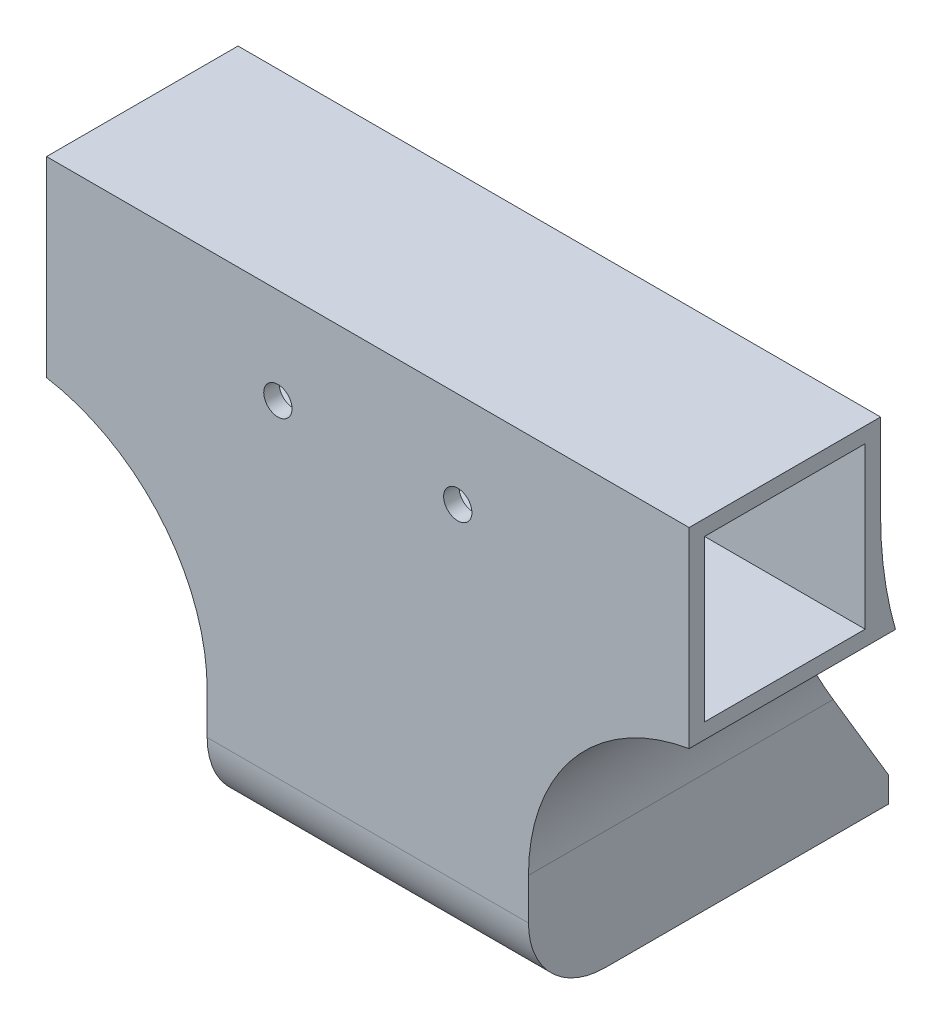
from build123d import *

# Parameters (mm, degrees)
SKETCH_1_W          = 25
SKETCH_1_H          = 25
EXTRUDE_1_DEPTH     = 100
EXTRUDE_1_2_DEPTH   = 48
SKETCH_3_W          = 50.00000000000001
SKETCH_3_H          = 4
EXTRUDE_2_DEPTH     = 42
EXTRUDE_3_DEPTH     = 4
EXTRUDE_4_DEPTH     = 4
FILLET_2_R          = 30
CUT_EXTRUDE_1_REACH = 135.199
SKETCH_6_R          = 11.500000000000005
SKETCH_6_R_2        = 1.6000000000000052
SKETCH_6_R_3        = 1.5999999999999974
SKETCH_6_R_4        = 1.600000000000006
FILLET_3_R          = 12
FILLET_4_R          = 60
SKETCH_7_R          = 2.1999999999999984
CUT_EXTRUDE_2_DEPTH = 122.8378021221657
FILLET_5_R          = 2
SKETCH_8_R          = 1.2000000000000004
SKETCH_8_R_2        = 1.1999999999999995
CUT_EXTRUDE_3_DEPTH = 5
EXTRUDE_START       = 1
SKETCH_9_R          = 1.2000000000000004
SKETCH_9_R_2        = 1.1999999999999986
EXTRUDE_5_DEPTH     = 1
FILLET_6_R          = 1


# Some blends are built 0.0001 mm under size
with BuildPart() as part:
    # Эскиз1 → Extrude 1 (new body)
    with BuildSketch(Plane(origin=(0, 0, 0), x_dir=(0, 0, -1), z_dir=(1, 0, 0))):
        Polygon((14.899999999999997, 14.899999999999999), (-14.900000000000006, 14.899999999999999), (-14.900000000000004, -14.899999999999999), (14.899999999999993, -14.900000000000002), align=None)
        Rectangle(SKETCH_1_W, SKETCH_1_H, mode=Mode.SUBTRACT)
    extrude(amount=EXTRUDE_1_DEPTH)

    # Эскиз2 → Extrude 1 2 (add)
    with BuildSketch(Plane.XZ.offset(14.900000000000002)):
        Polygon((25.000000000000007, 0.9000000000000085), (75.00000000000001, 0.9000000000000085), (75.00000000000001, 14.900000000000016), (25.000000000000007, 14.90000000000001), align=None)
    extrude(amount=EXTRUDE_1_2_DEPTH)

    # Эскиз3 → Бобышка-Вытянуть2 (add)
    with BuildSketch(Plane(origin=(0, 0, 0.9000000000000085), x_dir=(-1, 0, 0), z_dir=(0, 0, -1))):
        with Locations((-50.000000000000014, -60.89999999999999)):
            Rectangle(SKETCH_3_W, SKETCH_3_H)
    extrude(amount=EXTRUDE_2_DEPTH)

    # Эскиз4 → Бобышка-Вытянуть3 (add)
    with BuildSketch(Plane(origin=(75.00000000000001, 0, 0), x_dir=(0, 0, -1), z_dir=(1, 0, 0))):
        Polygon((14.899999999999997, -14.900000000000002), (41.099999999999994, -58.89999999999999), (-0.9000000000000085, -58.89999999999999), (-0.9000000000000032, -14.900000000000002), align=None)
    extrude(amount=-EXTRUDE_3_DEPTH)

    # Эскиз5 → Бобышка-Вытянуть4 (add)
    with BuildSketch(Plane.ZY.offset(-25.000000000000007)):
        Polygon((-41.099999999999994, -58.89999999999999), (-14.899999999999997, -14.900000000000002), (0.9000000000000032, -14.900000000000002), (0.9000000000000085, -58.89999999999999), align=None)
    extrude(amount=-EXTRUDE_4_DEPTH)

    # Скругление2
    # the kernel refuses this fillet: 30 mm, written as the material it adds along each edge
    with BuildSketch(Plane(origin=(75.00000000000001, -14.900000000000002, 14.900000000000016), x_dir=(1, -1.1724e-13, 0), z_dir=(0, 0, -1))) as fillet_2_piece_1_section:
        with BuildLine():
            CenterArc((30.000000000003467, 29.58039891549758), FILLET_2_R, 179.9999999999933, 80.40593177314048)
            Line((3.46799e-12, 29.580398915501096), (-0.5999999999965263, 29.580398915501167))
            Line((-0.5999999999965263, 29.580398915501167), (-0.5999999999999943, 7.034e-14))
            Line((-0.5999999999999943, 7.034e-14), (-7.034e-14, -0.5999999999999996))
            ThreePointArc((-7.034e-14, -0.5999999999999996), (12.50000000000017, -0.6000000000014687), (24.900000000000418, -0.5916079783099508))
            Line((24.900000000000418, -0.5916079783099508), (25.000000000000483, 0))
        make_face()
    fillet_2_piece_1 = extrude(amount=29.80000000000001, mode=Mode.PRIVATE)
    fillet_2_piece_1 = split(fillet_2_piece_1, bisect_by=Plane(origin=(81.1670170800043, -13.413841962792697, -14.0150604414811), z_dir=(0, -0.5116211753096359, 0.8592111341077854)), keep=Keep.TOP, mode=Mode.PRIVATE)
    add(fillet_2_piece_1)
    with BuildSketch(Plane(origin=(75.00000000000001, -14.900000000000002, 14.900000000000016), x_dir=(1, -1.1724e-13, 0), z_dir=(0, 0, -1))) as fillet_2_piece_2_section:
        with BuildLine():
            CenterArc((30.000000000003467, 29.58039891549758), FILLET_2_R, 179.9999999999933, 80.40593177314048)
            Line((3.46799e-12, 29.580398915501096), (-0.5999999999965263, 29.580398915501167))
            Line((-0.5999999999965263, 29.580398915501167), (-0.5999999999999943, 7.034e-14))
            Line((-0.5999999999999943, 7.034e-14), (-7.034e-14, -0.5999999999999996))
            ThreePointArc((-7.034e-14, -0.5999999999999996), (12.50000000000017, -0.6000000000014687), (24.900000000000418, -0.5916079783099508))
            Line((24.900000000000418, -0.5916079783099508), (25.000000000000483, 0))
        make_face()
    fillet_2_piece_2 = extrude(amount=103.75099728875276, mode=Mode.PRIVATE)
    fillet_2_piece_2 = split(fillet_2_piece_2, bisect_by=Plane(origin=(78.03670654551321, -27.69206450172471, -14.899999999999991), z_dir=(0, -1.2e-16, -1)), keep=Keep.TOP, mode=Mode.PRIVATE)
    fillet_2_piece_2 = split(fillet_2_piece_2, bisect_by=Plane(origin=(78.03670654551321, -26.01786323182673, -21.520182197133188), z_dir=(0, -0.5116211753096359, 0.8592111341077854)), keep=Keep.TOP, mode=Mode.PRIVATE)
    add(fillet_2_piece_2)
    with BuildSketch(Plane(origin=(75.00000000000001, -14.900000000000002, 14.900000000000016), x_dir=(1, -1.1724e-13, 0), z_dir=(0, 0, -1))) as fillet_2_piece_3_section:
        with BuildLine():
            CenterArc((30.000000000003467, 29.58039891549758), FILLET_2_R, 179.9999999999933, 80.40593177314048)
            Line((3.46799e-12, 29.580398915501096), (-0.5999999999965263, 29.580398915501167))
            Line((-0.5999999999965263, 29.580398915501167), (-0.5999999999999943, 7.034e-14))
            Line((-0.5999999999999943, 7.034e-14), (-7.034e-14, -0.5999999999999996))
            ThreePointArc((-7.034e-14, -0.5999999999999996), (12.50000000000017, -0.6000000000014687), (24.900000000000418, -0.5916079783099508))
            Line((24.900000000000418, -0.5916079783099508), (25.000000000000483, 0))
        make_face()
    fillet_2_piece_3 = extrude(amount=29.80000000000001, mode=Mode.PRIVATE)
    fillet_2_piece_3 = split(fillet_2_piece_3, bisect_by=Plane(origin=(87.30790234875249, -14.553945511924846, -14.6939402821007), z_dir=(0, 0.5116211753096359, -0.8592111341077854)), keep=Keep.TOP, mode=Mode.PRIVATE)
    add(fillet_2_piece_3)
    with BuildSketch(Plane(origin=(25.000000000000007, -14.900000000000011, -88.85099728875262), x_dir=(0, -1, 0), z_dir=(0, 0, 1))) as fillet_2_piece_4_section:
        with BuildLine():
            CenterArc((29.5803989155011, -30), FILLET_2_R, 90, 80.40593177314054)
            Line((2.93632e-12, -25.000000000000504), (-0.5916079783070263, -24.900000000000514))
            ThreePointArc((-0.5916079783070263, -24.900000000000514), (-0.5999999999999996, -12.500000000000252), (-0.5999999999999996, 0))
            Line((-0.5999999999999996, 0), (0, 0.6000000000000014))
            Line((0, 0.6000000000000014), (29.5803989155011, 0.6000000000000014))
            Line((29.5803989155011, 0.6000000000000014), (29.5803989155011, 0))
        make_face()
    fillet_2_piece_4 = extrude(amount=103.75099728875263, mode=Mode.PRIVATE)
    fillet_2_piece_4 = split(fillet_2_piece_4, bisect_by=Plane(origin=(21.96329345452578, -26.01786323182675, -21.5201821971332), z_dir=(0, -0.5116211753096359, 0.8592111341077854)), keep=Keep.TOP, mode=Mode.PRIVATE)
    fillet_2_piece_4 = split(fillet_2_piece_4, bisect_by=Plane(origin=(21.96329345452578, -27.69206450173281, -14.899999999999991), z_dir=(0, -1.2e-16, -1)), keep=Keep.TOP, mode=Mode.PRIVATE)
    add(fillet_2_piece_4)
    with BuildSketch(Plane(origin=(25.000000000000007, -14.900000000000002, -14.899999999999997), x_dir=(0, -1, 0), z_dir=(0, 0, 1))) as fillet_2_piece_5_section:
        with BuildLine():
            CenterArc((29.58039891550111, -30), FILLET_2_R, 90, 80.40593177314054)
            Line((2.9452e-12, -25.000000000000504), (-0.5916079783070174, -24.900000000000514))
            ThreePointArc((-0.5916079783070174, -24.900000000000514), (-0.5999999999999996, -12.500000000000252), (-0.5999999999999996, 0))
            Line((-0.5999999999999996, 0), (0, 0.6000000000000014))
            Line((0, 0.6000000000000014), (29.58039891550111, 0.6000000000000014))
            Line((29.58039891550111, 0.6000000000000014), (29.58039891550111, 0))
        make_face()
    fillet_2_piece_5 = extrude(amount=29.800000000000004, mode=Mode.PRIVATE)
    fillet_2_piece_5 = split(fillet_2_piece_5, bisect_by=Plane(origin=(12.6920976512564, -14.55394551192456, -14.693940282100531), z_dir=(0, 0.5116211753096359, -0.8592111341077854)), keep=Keep.TOP, mode=Mode.PRIVATE)
    add(fillet_2_piece_5)
    with BuildSketch(Plane(origin=(25.000000000000007, -14.900000000000002, -14.899999999999997), x_dir=(0, -1, 0), z_dir=(0, 0, 1))) as fillet_2_piece_6_section:
        with BuildLine():
            CenterArc((29.58039891550111, -30), FILLET_2_R, 90, 80.40593177314054)
            Line((2.9452e-12, -25.000000000000504), (-0.5916079783070174, -24.900000000000514))
            ThreePointArc((-0.5916079783070174, -24.900000000000514), (-0.5999999999999996, -12.500000000000252), (-0.5999999999999996, 0))
            Line((-0.5999999999999996, 0), (0, 0.6000000000000014))
            Line((0, 0.6000000000000014), (29.58039891550111, 0.6000000000000014))
            Line((29.58039891550111, 0.6000000000000014), (29.58039891550111, 0))
        make_face()
    fillet_2_piece_6 = extrude(amount=29.800000000000004, mode=Mode.PRIVATE)
    fillet_2_piece_6 = split(fillet_2_piece_6, bisect_by=Plane(origin=(18.83298291999507, -13.413841962792766, -14.015060441481143), z_dir=(0, -0.5116211753096359, 0.8592111341077854)), keep=Keep.TOP, mode=Mode.PRIVATE)
    add(fillet_2_piece_6)

    # Эскиз6 → Вырез-Вытянуть1 (cut, up to next)
    with BuildSketch(Plane.XZ.offset(62.9), mode=Mode.PRIVATE) as cut_extrude_1_sk1:
        with Locations(Location((50.00000000000001, -20.099999999999998, 0), (0, 0, 270))):
            Circle(SKETCH_6_R)
    cut_extrude_1_tool1 = extrude(cut_extrude_1_sk1.sketch, amount=-CUT_EXTRUDE_1_REACH, mode=Mode.PRIVATE) & part.part
    # Эскиз6 → Вырез-Вытянуть1 (cut, up to next)
    with BuildSketch(Plane.XZ.offset(62.9), mode=Mode.PRIVATE) as cut_extrude_1_sk2:
        with Locations(Location((34.50000000000001, -4.599999999999993, 0), (0, 0, 270))):
            Circle(SKETCH_6_R_2)
    cut_extrude_1_tool2 = extrude(cut_extrude_1_sk2.sketch, amount=-CUT_EXTRUDE_1_REACH, mode=Mode.PRIVATE) & part.part
    # Эскиз6 → Вырез-Вытянуть1 (cut, up to next)
    with BuildSketch(Plane.XZ.offset(62.9), mode=Mode.PRIVATE) as cut_extrude_1_sk3:
        with Locations(Location((65.5, -4.599999999999993, 0), (0, 0, 270))):
            Circle(SKETCH_6_R_2)
    cut_extrude_1_tool3 = extrude(cut_extrude_1_sk3.sketch, amount=-CUT_EXTRUDE_1_REACH, mode=Mode.PRIVATE) & part.part
    # Эскиз6 → Вырез-Вытянуть1 (cut, up to next)
    with BuildSketch(Plane.XZ.offset(62.9), mode=Mode.PRIVATE) as cut_extrude_1_sk4:
        with Locations(Location((34.50000000000001, -35.599999999999994, 0), (0, 0, 270))):
            Circle(SKETCH_6_R_3)
    cut_extrude_1_tool4 = extrude(cut_extrude_1_sk4.sketch, amount=-CUT_EXTRUDE_1_REACH, mode=Mode.PRIVATE) & part.part
    # Эскиз6 → Вырез-Вытянуть1 (cut, up to next)
    with BuildSketch(Plane.XZ.offset(62.9), mode=Mode.PRIVATE) as cut_extrude_1_sk5:
        with Locations(Location((65.5, -35.599999999999994, 0), (0, 0, 270))):
            Circle(SKETCH_6_R_4)
    cut_extrude_1_tool5 = extrude(cut_extrude_1_sk5.sketch, amount=-CUT_EXTRUDE_1_REACH, mode=Mode.PRIVATE) & part.part
    add(cut_extrude_1_tool1.solids().sort_by_distance((50, -62.9, -20.1))[0], mode=Mode.SUBTRACT)
    add(cut_extrude_1_tool2.solids().sort_by_distance((34.5, -62.9, -4.6))[0], mode=Mode.SUBTRACT)
    add(cut_extrude_1_tool3.solids().sort_by_distance((65.5, -62.9, -4.6))[0], mode=Mode.SUBTRACT)
    add(cut_extrude_1_tool4.solids().sort_by_distance((34.5, -62.9, -35.6))[0], mode=Mode.SUBTRACT)
    add(cut_extrude_1_tool5.solids().sort_by_distance((65.5, -62.9, -35.6))[0], mode=Mode.SUBTRACT)

    # Скругление3
    fillet_3_edges = [part.edges().sort_by_distance(p)[0] for p in [
        (50.000000000000014, -62.900000000000006, 14.900000000000013),
    ]]
    fillet(fillet_3_edges, radius=FILLET_3_R)

    # Скругление4
    fillet_4_edges = [part.edges().sort_by_distance(p)[0] for p in [
        (14.499999999999712, -14.900000000000967, -14.899999999999435),
        (85.49999999999991, -14.900000000000125, -14.899999999999999),
    ]]
    fillet(fillet_4_edges, radius=FILLET_4_R)

    # Эскиз7 → Вырез-Вытянуть2 (cut, through all)
    with BuildSketch(Plane(origin=(0, 0, -14.899999999999997), x_dir=(-1, 0, 0), z_dir=(0, 0, -1))):
        with Locations((-64, -7.84e-15)):
            Circle(SKETCH_7_R)
        with Locations((-36, -4.41e-15)):
            Circle(SKETCH_7_R)
    extrude(amount=-CUT_EXTRUDE_2_DEPTH, mode=Mode.SUBTRACT)

    # Скругление5
    fillet_5_edges = [part.edges().sort_by_distance(p)[0] for p in [
        (50.000000000000014, -14.900000000000002, -14.899999999999993),
    ]]
    fillet(fillet_5_edges, radius=FILLET_5_R)

    # Эскиз8 → Вырез-Вытянуть3 (cut)
    with BuildSketch(Plane.ZY.offset(-25.000000000000007)):
        with Locations((-25.099999999999998, -60.9)):
            Circle(SKETCH_8_R)
        with Locations((2.9000000000000035, -60.9)):
            Circle(SKETCH_8_R_2)
    extrude(amount=-CUT_EXTRUDE_3_DEPTH, mode=Mode.SUBTRACT)

    # Эскиз9 → Бобышка-Вытянуть5 (add)
    # profile 1 of 2: a face of its own
    with BuildSketch(Plane.ZY.offset(-25.000000000000007).offset(EXTRUDE_START)):
        with BuildLine():
            Line((-27.336067977499788, -62.9), (-22.863932022500208, -62.9))
            ThreePointArc((-22.863932022500208, -62.9), (-25.099999999999998, -57.9), (-27.336067977499788, -62.9))
        make_face()
        with Locations((-25.099999999999998, -60.9)):
            Circle(SKETCH_9_R, mode=Mode.SUBTRACT)
    # profile 2 of 2: a face of its own
    with BuildSketch(Plane.ZY.offset(-25.000000000000007).offset(EXTRUDE_START)):
        with BuildLine():
            Line((2.9000000000000035, -62.9), (0.6463835715880533, -62.9))
            ThreePointArc((0.6463835715880533, -62.9), (2.5917609374486457, -57.90270527196178), (5.513498770016945, -62.39947030164927))
            ThreePointArc((5.513498770016945, -62.39947030164927), (4.213782424449112, -62.686457926692185), (2.9000000000000035, -62.9))
        make_face()
        with Locations((2.9000000000000035, -60.9)):
            Circle(SKETCH_9_R_2, mode=Mode.SUBTRACT)
    extrude(amount=-EXTRUDE_5_DEPTH)

    # Скругление6
    fillet_6_edges = [part.edges().sort_by_distance(p)[0] for p in [
        (25.000000000000007, -57.90270527196177, 2.59176093744865),
        (25.000000000000007, -57.9, -25.099999999999998),
    ]]
    fillet(fillet_6_edges, radius=FILLET_6_R - 0.0001)  # a hair under: the kernel refuses the full size


solid = part.part
